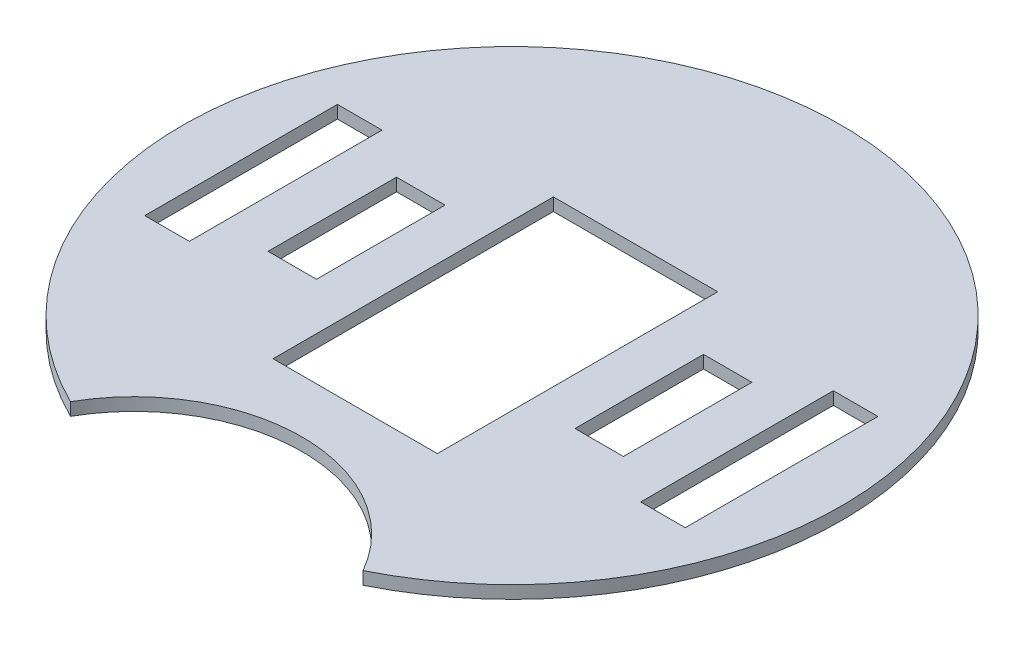
from build123d import *

# Parameters (mm, degrees)
BOSS_EXTRUDE1_DEPTH  = 2.9
SOLENOID_PLACEMENT_W = 37.4
SOLENOID_PLACEMENT_H = 63.8
CUT_EXTRUDE1_DEPTH   = 107.105654892
SKETCH2_W            = 10.149382017
SKETCH2_H            = 43.846971317
CUT_EXTRUDE2_DEPTH   = 107.105654892
SKETCH3_W            = 11.023122164
SKETCH3_H            = 29.238616442
CUT_EXTRUDE3_DEPTH   = 107.105654892


with BuildPart() as part:
    # Sketch1 → Boss-Extrude1 (new body)
    with BuildSketch(Plane(origin=(0, 0, 0), x_dir=(1, 0, 0), z_dir=(0, 1, 0))):
        with BuildLine():
            ThreePointArc((33.29110537, -67.206415641), (0, 75), (-33.29110537, -67.206415641))
            ThreePointArc((-33.29110537, -67.206415641), (0, -47.791616815), (33.29110537, -67.206415641))
        make_face()
    extrude(amount=BOSS_EXTRUDE1_DEPTH)

    # solenoid placement → Cut-Extrude1 (cut, through all)
    with BuildSketch(Plane(origin=(0, 2.9, 0), x_dir=(1, 0, 0), z_dir=(0, 1, 0))):
        with Locations((0, -3.8)):
            Rectangle(SOLENOID_PLACEMENT_W, SOLENOID_PLACEMENT_H)
    extrude(amount=-CUT_EXTRUDE1_DEPTH, mode=Mode.SUBTRACT)

    # Sketch2 → Cut-Extrude2 (cut, through all)
    with BuildSketch(Plane(origin=(0, 2.9, 0), x_dir=(1, 0, 0), z_dir=(0, 1, 0))):
        with Locations((56.433097696, -0.165843752)):
            Rectangle(SKETCH2_W, SKETCH2_H)
        with Locations((-56.433097696, -0.165843752)):
            Rectangle(SKETCH2_W, SKETCH2_H)
    extrude(amount=-CUT_EXTRUDE2_DEPTH, mode=Mode.SUBTRACT)

    # Sketch3 → Cut-Extrude3 (cut, through all)
    with BuildSketch(Plane(origin=(0, 2.9, 0), x_dir=(1, 0, 0), z_dir=(0, 1, 0))):
        with Locations((-34.92524858, -0.47002534)):
            Rectangle(SKETCH3_W, SKETCH3_H)
        with Locations((34.92524858, -0.47002534)):
            Rectangle(SKETCH3_W, SKETCH3_H)
    extrude(amount=-CUT_EXTRUDE3_DEPTH, mode=Mode.SUBTRACT)


solid = part.part
